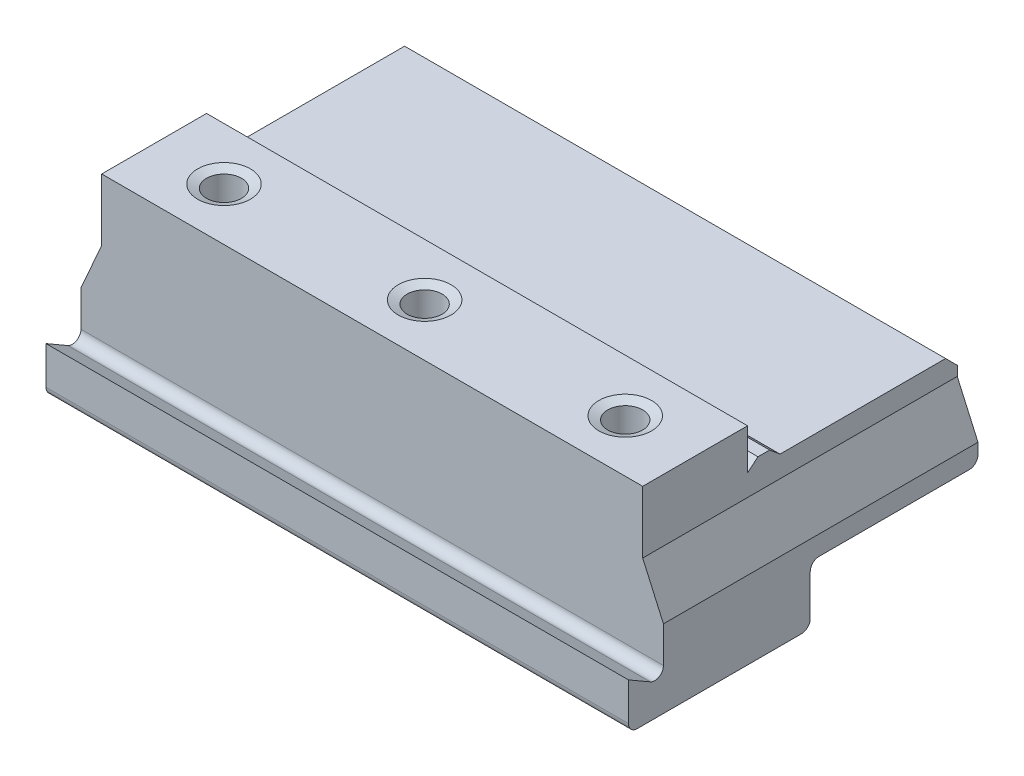
from build123d import *

# Parameters (mm, degrees)
BOSS_EXTRUDE1_DEPTH             = 100
CUT_EXTRUDE1_DEPTH              = 115.950260983
CUT_EXTRUDE1_DEPTH_BACK         = 115.950260983
F_6_0MM_DOWEL_HOLE1_D           = 6
F_6_0MM_DOWEL_HOLE1_DEPTH       = 8.197418143
F_6_0MM_DOWEL_HOLE1_CSINK_D     = 6.05
F_6_0MM_DOWEL_HOLE1_CSINK_ANGLE = 90
F_6_0MM_DOWEL_HOLE1_TIP         = 1.802581857
CHAMFER1_SIZE                   = 1.5


with BuildPart() as part:
    # Sketch1 → Boss-Extrude1 (new body)
    with BuildSketch(Plane(origin=(0, 0, 0), x_dir=(0, 0, -1), z_dir=(1, 0, 0))):
        with BuildLine():
            Line((-6, -9.25), (-6, -15.75))
            ThreePointArc((-6, -15.75), (-5.560660172, -16.810660172), (-4.5, -17.25))
            Line((-4.5, -17.25), (23.7, -17.25))
            ThreePointArc((23.7, -17.25), (24.760660172, -16.810660172), (25.2, -15.75))
            Line((25.2, -15.75), (25.2, -8.75))
            ThreePointArc((25.2, -8.75), (25.639339828, -7.689339828), (26.7, -7.25))
            Line((26.7, -7.25), (52.5, -7.25))
            ThreePointArc((52.5, -7.25), (53.560660172, -6.810660172), (54, -5.75))
            Line((54, -5.75), (54, 5.75))
            Line((54, 5.75), (52, 7.75))
            Line((52, 7.75), (23.575260778, 7.75))
            Line((23.575260778, 7.75), (21.787630389, 9.25))
            Line((21.787630389, 9.25), (19.787630389, 9.25))
            Line((19.787630389, 9.25), (18, 7.75))
            Line((18, 7.75), (18, 14.75))
            Line((18, 14.75), (0, 14.75))
            Line((0, 14.75), (0, -10.116025404))
            ThreePointArc((0, -10.116025404), (-0.75, -11.415063509), (-2.25, -11.415063509))
            Line((-2.25, -11.415063509), (-6, -9.25))
        make_face()
    extrude(amount=BOSS_EXTRUDE1_DEPTH)

    # Sketch2 → Cut-Extrude1 (cut, two sides: drawn at the far end of the back side and taken through both)
    with BuildSketch(Plane.XY.offset(-CUT_EXTRUDE1_DEPTH_BACK)):
        Polygon((96.438170518, 14.75), (96.438170518, 4.083333333), (100, -3.916666667), (100, 14.75), align=None)
        Polygon((0, 14.75), (3.561829482, 14.75), (3.561829482, 4.083333333), (0, -3.916666667), align=None)
    extrude(amount=CUT_EXTRUDE1_DEPTH + CUT_EXTRUDE1_DEPTH_BACK, mode=Mode.SUBTRACT)

    # Ø6.0mm Dowel Hole1
    with Locations(Plane(origin=(0, 14.75, 0), x_dir=(1, 0, 0), z_dir=(0, 1, 0))):
        with Locations((15.561829482, 9), (50, 9), (84.438170518, 9)):
            CounterSinkHole(F_6_0MM_DOWEL_HOLE1_D / 2, F_6_0MM_DOWEL_HOLE1_CSINK_D / 2, depth=F_6_0MM_DOWEL_HOLE1_DEPTH, counter_sink_angle=F_6_0MM_DOWEL_HOLE1_CSINK_ANGLE)
            with Locations((0, 0, -(F_6_0MM_DOWEL_HOLE1_DEPTH + F_6_0MM_DOWEL_HOLE1_TIP / 2))):  # 118° drill point
                Cone(0, F_6_0MM_DOWEL_HOLE1_D / 2, F_6_0MM_DOWEL_HOLE1_TIP, mode=Mode.SUBTRACT)

    # Chamfer1
    # the kernel refuses this chamfer: 1.5 mm, written as the material it takes off along each edge
    with BuildSketch(Plane(origin=(84.438170518, 14.75, -9), x_dir=(-1, 0, 0), z_dir=(0, 0, 1))) as chamfer1_piece_1:
        Polygon((3.025 + CHAMFER1_SIZE, 0), (3.025 - CHAMFER1_SIZE * 0.707106781187, CHAMFER1_SIZE * 0.707106781187), (3.025, 0), align=None)
    revolve(axis=Axis((84.438170518, 14.75, -9), (0, -1, 0)), mode=Mode.SUBTRACT)
    with BuildSketch(Plane(origin=(50, 14.75, -9), x_dir=(-1, 0, 0), z_dir=(0, 0, 1))) as chamfer1_piece_2:
        Polygon((3.025 + CHAMFER1_SIZE, 0), (3.025 - CHAMFER1_SIZE * 0.707106781187, CHAMFER1_SIZE * 0.707106781187), (3.025, 0), align=None)
    revolve(axis=Axis((50, 14.75, -9), (0, -1, 0)), mode=Mode.SUBTRACT)
    with BuildSketch(Plane(origin=(15.561829482, 14.75, -9), x_dir=(-1, 0, 0), z_dir=(0, 0, 1))) as chamfer1_piece_3:
        Polygon((3.025 + CHAMFER1_SIZE, 0), (3.025 - CHAMFER1_SIZE * 0.707106781187, CHAMFER1_SIZE * 0.707106781187), (3.025, 0), align=None)
    revolve(axis=Axis((15.561829482, 14.75, -9), (0, -1, 0)), mode=Mode.SUBTRACT)


solid = part.part
